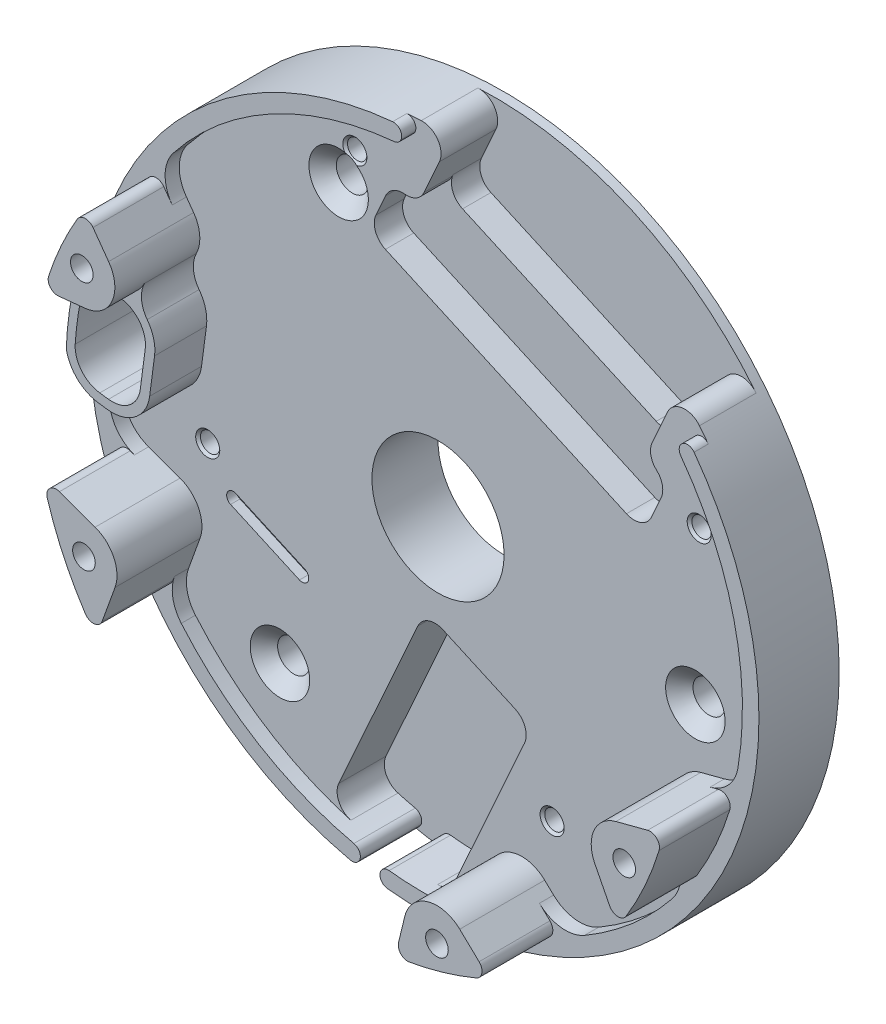
from build123d import *
from build123d.topology import SkipClean

# Parameters (mm, degrees)
BOSS_EXTRUDE1_DEPTH                                 = 5
BOSS_EXTRUDE1_DEPTH_BACK                            = 2
SKETCH1_R                                           = 35.5
SKETCH1_R_2                                         = 1.5
SKETCH1_R_3                                         = 7
CUT_EXTRUDE2_REACH                                  = 52.69
FILLET1_R                                           = 4
BOSS_EXTRUDE2_START                                 = -12.5
BOSS_EXTRUDE2_DEPTH                                 = 12.5
M2_5_TAPPED_HOLE1_D                                 = 2.05
M2_5_TAPPED_HOLE1_CSINK_D                           = 2.55
M2_5_TAPPED_HOLE1_CSINK_ANGLE                       = 90
CSK_FOR_M3_COUNTERSUNK_FLAT_HEAD_SCREW1_D           = 3.4
CSK_FOR_M3_COUNTERSUNK_FLAT_HEAD_SCREW1_DEPTH       = 7
CSK_FOR_M3_COUNTERSUNK_FLAT_HEAD_SCREW1_CSINK_D     = 6.3
CSK_FOR_M3_COUNTERSUNK_FLAT_HEAD_SCREW1_CSINK_ANGLE = 90
SKETCH8_R                                           = 2.75
CUT_EXTRUDE6_DEPTH                                  = 2.2
CUT_EXTRUDE7_DEPTH                                  = 51.690235746
CUT_EXTRUDE7_DEPTH_BACK                             = 6
CUT_EXTRUDE8_START                                  = -5
CUT_EXTRUDE8_DEPTH                                  = 5
CUT_EXTRUDE9_DEPTH                                  = 3
CUT_EXTRUDE10_DEPTH                                 = 1
FILLET2_R                                           = 2
FILLET3_R                                           = 2
BOSS_EXTRUDE3_DEPTH                                 = 1.5
BOSS_EXTRUDE3_DIRECTION_2_REACH                     = 52.69
BOSS_EXTRUDE4_DEPTH                                 = 9
CUT_EXTRUDE11_REACH                                 = 52.919
SKETCH21_R                                          = 35.5
SKETCH21_R_2                                        = 33.9
BOSS_EXTRUDE6_DEPTH                                 = 5.5
FILLET4_R                                           = 0.875
FILLET5_R                                           = 4
FILLET6_R                                           = 1
FILLET7_R                                           = 3
FILLET8_R                                           = 2


# Read off the part's stored shape, not the designer's step: M2 Tapped Hole2, M2 Clearance Hole1
with BuildPart() as part:
    # Sketch1 → Boss-Extrude1 (new, two sides: drawn at the far end of the back side and taken through both)
    with BuildSketch(Plane.XY.offset(-BOSS_EXTRUDE1_DEPTH_BACK)):
        Circle(SKETCH1_R)
        with Locations((-10.52379439, 25.406687144)):
            Circle(SKETCH1_R_2, mode=Mode.SUBTRACT)
        with Locations((27.264733688, -3.589470286)):
            Circle(SKETCH1_R_2, mode=Mode.SUBTRACT)
        with Locations((-16.740939298, -21.817216858)):
            Circle(SKETCH1_R_2, mode=Mode.SUBTRACT)
        Circle(SKETCH1_R_3, mode=Mode.SUBTRACT)
    extrude(amount=BOSS_EXTRUDE1_DEPTH + BOSS_EXTRUDE1_DEPTH_BACK)

    # Sketch2 → Cut-Extrude2 (cut, up to next)
    with BuildSketch(Plane(origin=(0, 0, -2), x_dir=(-1, 0, 0), z_dir=(0, 0, -1)), mode=Mode.PRIVATE) as cut_extrude2_sk1:
        with BuildLine():
            Line((32.396934208, 10.316911066), (24.002964381, 9.211823974))
            Line((24.002964381, 9.211823974), (25.569278688, -2.685514363))
            Line((25.569278688, -2.685514363), (33.963248514, -1.58042727))
            ThreePointArc((33.963248514, -1.58042727), (33.709125287, 4.437890535), (32.396934208, 10.316911066))
        make_face()
    cut_extrude2_tool1 = extrude(cut_extrude2_sk1.sketch, amount=-CUT_EXTRUDE2_REACH, mode=Mode.PRIVATE) & part.part
    add(cut_extrude2_tool1.solids().sort_by_distance((-29.161149, 3.839138, -2))[0], mode=Mode.SUBTRACT)

    # Fillet1
    fillet1_edges = [part.edges().sort_by_distance(p)[0] for p in [
        (-32.396934208, 10.316911066, 1.5),
        (-33.963248514, -1.58042727, 1.5),
        (-25.569278688, -2.685514363, 1.5),
        (-24.002964381, 9.211823974, 1.5),
    ]]
    fillet(fillet1_edges, radius=FILLET1_R)

    # Sketch3 → Boss-Extrude2 (add)
    with BuildSketch(Plane(origin=(0, 0, -2), x_dir=(-1, 0, 0), z_dir=(0, 0, -1)).offset(BOSS_EXTRUDE2_START)):
        with BuildLine():
            Line((24.52506915, 5.246044528), (25.047173919, 1.280265083))
            ThreePointArc((25.047173919, 1.280265083), (26.577907648, -1.37104351), (29.535058133, -2.163409594))
            Line((29.535058133, -2.163409594), (30.460333066, -2.041594838))
            ThreePointArc((30.460333066, -2.041594838), (33.028662825, -0.615345749), (33.929992071, 2.180742555))
            ThreePointArc((33.929992071, 2.180742555), (33.709125287, 4.437890535), (33.338273332, 6.675292593))
            ThreePointArc((33.338273332, 6.675292593), (31.743975231, 9.142825324), (28.89401876, 9.855743499))
            Line((28.89401876, 9.855743499), (27.968743827, 9.733928743))
            ThreePointArc((27.968743827, 9.733928743), (25.317435234, 8.203195013), (24.52506915, 5.246044528))
        make_face()
        with BuildLine():
            Line((25.516514011, 5.37657072), (26.03861878, 1.410791275))
            ThreePointArc((26.03861878, 1.410791275), (27.186669077, -0.577690169), (29.404531941, -1.171964732))
            Line((29.404531941, -1.171964732), (30.329806874, -1.050149977))
            ThreePointArc((30.329806874, -1.050149977), (32.256054193, 0.01953684), (32.932051127, 2.116603068))
            ThreePointArc((32.932051127, 2.116603068), (32.717680425, 4.307364343), (32.357735882, 6.478960458))
            ThreePointArc((32.357735882, 6.478960458), (31.162012306, 8.329610007), (29.024544952, 8.864298637))
            Line((29.024544952, 8.864298637), (28.099270019, 8.742483881))
            ThreePointArc((28.099270019, 8.742483881), (26.110788575, 7.594433584), (25.516514011, 5.37657072))
        make_face(mode=Mode.SUBTRACT)
    extrude(amount=BOSS_EXTRUDE2_DEPTH)

    # M2.5 Tapped Hole1 (through all)
    with Locations(Plane.XY.offset(5)):
        with Locations((-8.808106595, 29.179055129), (27.673288448, 12.77454917), (12.089007787, -21.88277612), (-24.392387256, -5.478270161)):
            CounterSinkHole(M2_5_TAPPED_HOLE1_D / 2, M2_5_TAPPED_HOLE1_CSINK_D / 2, counter_sink_angle=M2_5_TAPPED_HOLE1_CSINK_ANGLE)

    # CSK for M3 Countersunk Flat Head Screw1
    with Locations(Plane.XY.offset(5)):
        with Locations((-10.52379439, 25.406687144), (27.264733688, -3.589470286), (-16.740939298, -21.817216858)):
            CounterSinkHole(CSK_FOR_M3_COUNTERSUNK_FLAT_HEAD_SCREW1_D / 2, CSK_FOR_M3_COUNTERSUNK_FLAT_HEAD_SCREW1_CSINK_D / 2, depth=CSK_FOR_M3_COUNTERSUNK_FLAT_HEAD_SCREW1_DEPTH, counter_sink_angle=CSK_FOR_M3_COUNTERSUNK_FLAT_HEAD_SCREW1_CSINK_ANGLE)

    # Sketch8 → Cut-Extrude6 (cut)
    with BuildSketch(Plane(origin=(0, 0, -2), x_dir=(-1, 0, 0), z_dir=(0, 0, -1))):
        with Locations((10.52379439, 25.406687144)):
            Circle(SKETCH8_R)
        with Locations((16.740939298, -21.817216858)):
            Circle(SKETCH8_R)
        with Locations((-27.264733688, -3.589470286)):
            Circle(SKETCH8_R)
    extrude(amount=-CUT_EXTRUDE6_DEPTH, mode=Mode.SUBTRACT)

    # Sketch9 → Cut-Extrude7 (cut, two sides: drawn at the far end of the back side and taken through both)
    with BuildSketch(Plane.XY.offset(5).offset(-CUT_EXTRUDE7_DEPTH_BACK)):
        Polygon((75.817321638, 200.915630738), (1.422431593, 35.471491206), (-2.2212529, 27.368431368), (21.947671316, 16.50044617), (25.591355809, 24.603506008), (99.986245853, 190.04764554), (248.776025942, 520.935924604), (224.607101727, 531.803909802), align=None)
    extrude(amount=CUT_EXTRUDE7_DEPTH + CUT_EXTRUDE7_DEPTH_BACK, mode=Mode.SUBTRACT)

    # Sketch10 → Cut-Extrude8 (cut)
    with BuildSketch(Plane.XY.offset(5).offset(CUT_EXTRUDE8_START)):
        with BuildLine():
            Line((-1.319723163, -9.274606772), (-12.148608512, -33.35657823))
            ThreePointArc((-12.148608512, -33.35657823), (-5.929149168, -35.001359833), (0.485025181, -35.496686473))
            Line((0.485025181, -35.496686473), (9.9895093, -14.360003619))
            Line((9.9895093, -14.360003619), (-1.319723163, -9.274606772))
        make_face()
    extrude(amount=CUT_EXTRUDE8_DEPTH, mode=Mode.SUBTRACT)

    # Sketch11 → Cut-Extrude9 (cut)
    with BuildSketch(Plane.XY.offset(5)):
        Polygon((-4.729348809, 28.496241153), (24.455767225, 15.372636386), (21.790035007, 9.444409691), (-7.395081027, 22.568014458), align=None)
    extrude(amount=-CUT_EXTRUDE9_DEPTH, mode=Mode.SUBTRACT)

    # Sketch12 → Cut-Extrude10 (cut)
    with BuildSketch(Plane.XY.offset(5)):
        with BuildLine():
            Line((-21.40042799, -8.577976559), (-14.104148981, -11.858877751))
            ThreePointArc((-14.104148981, -11.858877751), (-13.752803423, -12.784381018), (-14.67830669, -13.135726577))
            Line((-14.67830669, -13.135726577), (-21.974585699, -9.854825385))
            ThreePointArc((-21.974585699, -9.854825385), (-22.325931258, -8.929322118), (-21.40042799, -8.577976559))
        make_face()
    extrude(amount=-CUT_EXTRUDE10_DEPTH, mode=Mode.SUBTRACT)

    # Fillet2
    fillet2_edges = [part.edges().sort_by_distance(p)[0] for p in [
        (1.422431593, 35.471491206, 2),
        (25.591355809, 24.603506008, 2),
        (-2.2212529, 27.368431368, 0.5),
        (21.947671316, 16.50044617, 0.5),
        (-7.395081027, 22.568014458, 3.5),
        (-4.729348809, 28.496241153, 3.5),
        (24.455767225, 15.372636386, 3.5),
        (21.790035007, 9.444409691, 3.5),
    ]]
    fillet(fillet2_edges, radius=FILLET2_R)

    # Fillet3
    fillet3_edges = [part.edges().sort_by_distance(p)[0] for p in [
        (-2.2212529, 27.368431368, 3.5),
        (21.947671316, 16.50044617, 3.5),
    ]]
    fillet(fillet3_edges, radius=FILLET3_R)

    # Sketch13 → Boss-Extrude3 (add)
    with SkipClean():  # the faces are left unmerged after this step: merging them gives an invalid solid
        with BuildSketch(Plane.XY.offset(5)):
            with BuildLine():
                Line((-6.352709332, -33.146728106), (-7.089353949, -34.784925766))
                ThreePointArc((-7.089353949, -34.784925766), (-35.400529869, 2.655651525), (-1.820273042, 35.453301765))
                Line((-1.820273042, 35.453301765), (-2.632427, 33.647181577))
                ThreePointArc((-2.632427, 33.647181577), (-33.697770867, 1.876895995), (-6.352709332, -33.146728106))
            make_face()
            with BuildLine():
                Line((-4.306998446, -33.4740536), (-5.055315747, -35.138209725))
                ThreePointArc((-5.055315747, -35.138209725), (-2.292163903, -35.425922495), (0.485025181, -35.496686473))
                ThreePointArc((0.485025181, -35.496686473), (32.097560493, -15.165639136), (27.729656943, 22.165651938))
                Line((27.729656943, 22.165651938), (26.917502984, 20.35953175))
                ThreePointArc((26.917502984, 20.35953175), (29.19456211, -16.933400226), (-4.306998446, -33.4740536))
            make_face()
        extrude(amount=BOSS_EXTRUDE3_DEPTH)

    # Boss-Extrude3 direction 2: up to this face of the body (flat: up to its plane)
    boss_extrude3_direction_2_end = Plane(part.part.faces().sort_by_distance((-0.958119383, -23.267547359, 0))[0])
    # Sketch13 → Boss-Extrude3 direction 2 (add, up to the picked face)
    with BuildSketch(Plane.XY.offset(5), mode=Mode.PRIVATE) as boss_extrude3_direction_2_sk1:
        with BuildLine():
            Line((-6.352709332, -33.146728106), (-7.089353949, -34.784925766))
            ThreePointArc((-7.089353949, -34.784925766), (-35.400529869, 2.655651525), (-1.820273042, 35.453301765))
            Line((-1.820273042, 35.453301765), (-2.632427, 33.647181577))
            ThreePointArc((-2.632427, 33.647181577), (-33.697770867, 1.876895995), (-6.352709332, -33.146728106))
        make_face()
    boss_extrude3_direction_2_tool1 = split(extrude(boss_extrude3_direction_2_sk1.sketch, amount=-BOSS_EXTRUDE3_DIRECTION_2_REACH, mode=Mode.PRIVATE), bisect_by=boss_extrude3_direction_2_end, keep=Keep.BOTH, mode=Mode.PRIVATE)
    # Sketch13 → Boss-Extrude3 direction 2 (add, up to the picked face)
    with BuildSketch(Plane.XY.offset(5), mode=Mode.PRIVATE) as boss_extrude3_direction_2_sk2:
        with BuildLine():
            Line((-4.306998446, -33.4740536), (-5.055315747, -35.138209725))
            ThreePointArc((-5.055315747, -35.138209725), (-2.292163903, -35.425922495), (0.485025181, -35.496686473))
            ThreePointArc((0.485025181, -35.496686473), (32.097560493, -15.165639136), (27.729656943, 22.165651938))
            Line((27.729656943, 22.165651938), (26.917502984, 20.35953175))
            ThreePointArc((26.917502984, 20.35953175), (29.19456211, -16.933400226), (-4.306998446, -33.4740536))
        make_face()
    boss_extrude3_direction_2_tool2 = split(extrude(boss_extrude3_direction_2_sk2.sketch, amount=-BOSS_EXTRUDE3_DIRECTION_2_REACH, mode=Mode.PRIVATE), bisect_by=boss_extrude3_direction_2_end, keep=Keep.BOTH, mode=Mode.PRIVATE)
    add(boss_extrude3_direction_2_tool1.solids().sort_by(Axis((-2.936786, 34.869702, 5), (0, 0, -1)))[0])
    add(boss_extrude3_direction_2_tool2.solids().sort_by(Axis((-4.038185, -34.595256, 5), (0, 0, -1)))[0])

    # Sketch14 → Boss-Extrude4 (add)
    with SkipClean():  # the faces are left unmerged after this step: merging them gives an invalid solid
        with BuildSketch(Plane.XY.offset(5)):
            with BuildLine():
                Line((27.845637941, -9.531883819), (32.88927519, -8.21617779))
                ThreePointArc((32.88927519, -8.21617779), (30.917982298, -13.9028188), (27.972133554, -19.151233496))
                Line((27.972133554, -19.151233496), (25.609344635, -14.505096652))
                ThreePointArc((25.609344635, -14.505096652), (25.53697653, -11.483154171), (27.845637941, -9.531883819))
            make_face()
            with BuildLine():
                Line((5.486533564, -29.396393477), (4.467720012, -33.604307431))
                ThreePointArc((4.467720012, -33.604307431), (9.565446748, -32.522488043), (14.437131, -30.672124942))
                Line((14.437131, -30.672124942), (11.302377395, -27.685849548))
                ThreePointArc((11.302377395, -27.685849548), (7.900663981, -26.862232012), (5.486533564, -29.396393477))
            make_face()
            with BuildLine():
                Line((-27.318831353, -10.112586624), (-32.919360528, -8.094794773))
                ThreePointArc((-32.919360528, -8.094794773), (-30.677006402, -14.426755636), (-27.230169011, -20.192273167))
                Line((-27.230169011, -20.192273167), (-25.212377159, -14.591743992))
                ThreePointArc((-25.212377159, -14.591743992), (-25.337940391, -11.91590436), (-27.318831353, -10.112586624))
            make_face()
            with BuildLine():
                Line((-28.376125466, 9.436392506), (-32.683546689, 8.999765319))
                ThreePointArc((-32.683546689, 8.999765319), (-30.917982298, 13.9028188), (-28.421790506, 18.477332719))
                Line((-28.421790506, 18.477332719), (-25.889949659, 14.965310108))
                ThreePointArc((-25.889949659, 14.965310108), (-25.53697653, 11.483154171), (-28.376125466, 9.436392506))
            make_face()
        extrude(amount=BOSS_EXTRUDE4_DEPTH)

    # M2 Tapped Hole2 outline → M2 Tapped Hole2 (revolve, cut)
    with SkipClean():  # the faces are left unmerged after this step: merging them gives an invalid solid
        with BuildSketch(Plane(origin=(28.729098596, -12.918548443, 0), x_dir=(1, 0, 0), z_dir=(0, -1, 0))):
            Polygon((0, 14), (0, -0.480688495), (0.8, 0), (0.8, 14), align=None)
        revolve(axis=Axis((28.729098596, -12.918548443, 0), (0, 0, 1)), mode=Mode.SUBTRACT)

    # M2 Tapped Hole2 2 outline → M2 Tapped Hole2 2 (revolve, cut)
    with SkipClean():  # the faces are left unmerged after this step: merging them gives an invalid solid
        with BuildSketch(Plane(origin=(8.888246978, -30.220011013, 0), x_dir=(1, 0, 0), z_dir=(0, -1, 0))):
            Polygon((0, 14), (0, -0.480688495), (0.8, 0), (0.8, 14), align=None)
        revolve(axis=Axis((8.888246978, -30.220011013, 0), (0, 0, 1)), mode=Mode.SUBTRACT)

    # M2 Tapped Hole2 3 outline → M2 Tapped Hole2 3 (revolve, cut)
    with SkipClean():  # the faces are left unmerged after this step: merging them gives an invalid solid
        with BuildSketch(Plane(origin=(-28.50518294, -13.405392405, 0), x_dir=(1, 0, 0), z_dir=(0, -1, 0))):
            Polygon((0, 14), (0, -0.480688495), (0.8, 0), (0.8, 14), align=None)
        revolve(axis=Axis((-28.50518294, -13.405392405, 0), (0, 0, 1)), mode=Mode.SUBTRACT)

    # M2 Tapped Hole2 4 outline → M2 Tapped Hole2 4 (revolve, cut)
    with SkipClean():  # the faces are left unmerged after this step: merging them gives an invalid solid
        with BuildSketch(Plane(origin=(-28.729098596, 12.918548443, 0), x_dir=(1, 0, 0), z_dir=(0, -1, 0))):
            Polygon((0, 14), (0, -0.480688495), (0.8, 0), (0.8, 14), align=None)
        revolve(axis=Axis((-28.729098596, 12.918548443, 0), (0, 0, 1)), mode=Mode.SUBTRACT)

    # M2 Clearance Hole1 outline → M2 Clearance Hole1 (revolve, cut)
    with SkipClean():  # the faces are left unmerged after this step: merging them gives an invalid solid
        with BuildSketch(Plane(origin=(28.729098596, -12.918548443, 0), x_dir=(1, 0, 0), z_dir=(0, -1, 0))):
            Polygon((0.8, 14), (0.8, 8.759655752), (1.2, 9), (1.2, 14), align=None)
        revolve(axis=Axis((28.729098596, -12.918548443, 0), (0, 0, 1)), mode=Mode.SUBTRACT)

    # M2 Clearance Hole1 2 outline → M2 Clearance Hole1 2 (revolve, cut)
    with SkipClean():  # the faces are left unmerged after this step: merging them gives an invalid solid
        with BuildSketch(Plane(origin=(8.888246978, -30.220011013, 0), x_dir=(1, 0, 0), z_dir=(0, -1, 0))):
            Polygon((0.8, 14), (0.8, 8.759655752), (1.2, 9), (1.2, 14), align=None)
        revolve(axis=Axis((8.888246978, -30.220011013, 0), (0, 0, 1)), mode=Mode.SUBTRACT)

    # M2 Clearance Hole1 3 outline → M2 Clearance Hole1 3 (revolve, cut)
    with SkipClean():  # the faces are left unmerged after this step: merging them gives an invalid solid
        with BuildSketch(Plane(origin=(-28.50518294, -13.405392405, 0), x_dir=(1, 0, 0), z_dir=(0, -1, 0))):
            Polygon((0.8, 14), (0.8, 8.759655752), (1.2, 9), (1.2, 14), align=None)
        revolve(axis=Axis((-28.50518294, -13.405392405, 0), (0, 0, 1)), mode=Mode.SUBTRACT)

    # M2 Clearance Hole1 4 outline → M2 Clearance Hole1 4 (revolve, cut)
    with SkipClean():  # the faces are left unmerged after this step: merging them gives an invalid solid
        with BuildSketch(Plane(origin=(-28.729098596, 12.918548443, 0), x_dir=(1, 0, 0), z_dir=(0, -1, 0))):
            Polygon((0.8, 14), (0.8, 8.759655752), (1.2, 9), (1.2, 14), align=None)
        revolve(axis=Axis((-28.729098596, 12.918548443, 0), (0, 0, 1)), mode=Mode.SUBTRACT)

    # Sketch21 → Cut-Extrude11 (cut, up to next)
    with BuildSketch(Plane.XY.offset(6.5), mode=Mode.PRIVATE) as cut_extrude11_sk1:
        Circle(SKETCH21_R)
        Circle(SKETCH21_R_2, mode=Mode.SUBTRACT)
    cut_extrude11_tool1 = extrude(cut_extrude11_sk1.sketch, amount=CUT_EXTRUDE11_REACH, mode=Mode.PRIVATE) & part.part
    add(cut_extrude11_tool1.solids().sort_by_distance((-34.495908, 0, 6.5))[0], mode=Mode.SUBTRACT)

    # Sketch22 → Boss-Extrude6 (add)
    with SkipClean():  # the faces are left unmerged after this step: merging them gives an invalid solid
        with BuildSketch(Plane.XY.offset(5)):
            with BuildLine():
                Line((-31.819620576, 9.08733828), (-32.683546689, 8.999765319))
                ThreePointArc((-32.683546689, 8.999765319), (-32.870359477, 8.291529888), (-33.041827087, 7.579423644))
                ThreePointArc((-33.041827087, 7.579423644), (-32.523576927, 8.408640964), (-31.819620576, 9.08733828))
            make_face()
        extrude(amount=BOSS_EXTRUDE6_DEPTH)

    # Fillet4
    # the kernel refuses this fillet: 0.875 mm, written as the material it takes off along each edge
    with BuildSketch(Plane(origin=(-2.632427, 33.647181577, 5), x_dir=(-0.9963387292935687, -0.08549348811270209, 0), z_dir=(0, 0, 1))) as fillet4_piece_1:
        with BuildLine():
            CenterArc((0.514232565, -0.874975254), FILLET4_R, 90.430912371, 60.452773243)
            Line((-0.25019693, -0.449214115), (0, 0))
            ThreePointArc((0, 0), (0.253825946, -0.000954497), (0.507651892, 0))
        make_face()
    extrude(amount=2.785476141, mode=Mode.SUBTRACT)
    with BuildSketch(Plane(origin=(-1.820273042, 35.453301765, 5), x_dir=(-0.41011264897732513, -0.9120348760594637, 0), z_dir=(0, 0, 1))) as fillet4_piece_2:
        with BuildLine():
            CenterArc((1.466128757, -0.875), FILLET4_R, 90, 119.547226757)
            ThreePointArc((0.704922932, -1.306498195), (0.34563133, -0.656934307), (0, 0))
            Line((0, 0), (1.466128757, 0))
        make_face()
    extrude(amount=5.211345674, mode=Mode.SUBTRACT)
    with BuildSketch(Plane(origin=(27.729656943, 22.165651938, 5), x_dir=(-0.41011264897733873, -0.9120348760594577, 0), z_dir=(0, 0, 1))) as fillet4_piece_3:
        with BuildLine():
            CenterArc((1.466128757, 0.875), FILLET4_R, 150.452773243, 119.547226757)
            ThreePointArc((0.704922932, 1.306498195), (0.34563133, 0.656934307), (0, 0))
            Line((0, 0), (1.466128757, 0))
        make_face()
    extrude(amount=5.211345674, mode=Mode.SUBTRACT)
    with BuildSketch(Plane(origin=(26.917502984, 20.35953175, 5), x_dir=(0.4101126489773329, 0.9120348760594602, 0), z_dir=(0, 0, 1))) as fillet4_piece_4:
        with BuildLine():
            CenterArc((0.514190456, -0.875), FILLET4_R, 90, 60.452773243)
            ThreePointArc((-0.247015369, -0.443501805), (-0.122673804, -0.222215345), (0, 0))
            Line((0, 0), (0.514190456, 0))
        make_face()
    extrude(amount=2.785476141, mode=Mode.SUBTRACT)
    with BuildSketch(Plane(origin=(-4.306998446, -33.4740536, 5), x_dir=(0.9929792584712338, -0.11828859727767001, 0), z_dir=(0, 0, -1))) as fillet4_piece_5:
        with BuildLine():
            CenterArc((0.642545255, 0.874961363), FILLET4_R, 197.418568486, 72.042993881)
            Line((-0.19233019, 0.613030089), (0, 0))
            ThreePointArc((0, 0), (0.317161277, 0.001490274), (0.634322555, 0))
        make_face()
    extrude(amount=5, mode=Mode.SUBTRACT)
    with BuildSketch(Plane(origin=(-6.352709332, -33.146728106, 5), x_dir=(-0.9790021466235207, 0.20384993722475947, 0), z_dir=(0, 0, -1))) as fillet4_piece_6:
        with BuildLine():
            CenterArc((1.089223617, -0.874888969), FILLET4_R, 90.912768644, 101.536959033)
            Line((0.23479877, -1.063524016), (0, 0))
            ThreePointArc((0, 0), (0.53764237, -0.004282632), (1.075284741, 0))
        make_face()
    extrude(amount=5, mode=Mode.SUBTRACT)
    with BuildSketch(Plane(origin=(-5.055315747, -35.138209725, 5), x_dir=(0.9920688711319626, -0.12569548492668045, 0), z_dir=(0, 0, -1))) as fillet4_piece_7:
        with BuildLine():
            CenterArc((1.182262216, -0.874875637), FILLET4_R, 89.03398439, 107.957006118)
            Line((0.345455338, -1.130569298), (0, 0))
            ThreePointArc((0, 0), (0.598507075, 0.00504558), (1.197014151, 0))
        make_face()
    extrude(amount=5, mode=Mode.SUBTRACT)
    with BuildSketch(Plane(origin=(-7.089353949, -34.784925766, 5), x_dir=(-0.9777935246502878, 0.20957056842974606, 0), z_dir=(0, 0, -1))) as fillet4_piece_8:
        with BuildLine():
            CenterArc((0.7071213, 0.874955513), FILLET4_R, 192.114723777, 78.463040967)
            Line((-0.14839187, 0.691319416), (0, 0))
            ThreePointArc((0, 0), (0.35797228, -0.001804893), (0.71594456, 0))
        make_face()
    extrude(amount=5, mode=Mode.SUBTRACT)
    with BuildSketch(Plane(origin=(-7.089353949, -34.784925766, 5), x_dir=(0.4101126489773508, 0.9120348760594521, 0), z_dir=(0, 0, 1))) as fillet4_piece_9:
        with BuildLine():
            CenterArc((0.70706625, 0.875), FILLET4_R, 191.536959033, 78.463040967)
            ThreePointArc((-0.15025516, 0.7), (-0.076892277, 0.349621207), (0, 0))
            Line((0, 0), (0.70706625, 0))
        make_face()
    extrude(amount=3.2898614, mode=Mode.SUBTRACT)
    with BuildSketch(Plane(origin=(-5.055315747, -35.138209725, 5), x_dir=(0.9920688711319626, -0.12569548492668045, 0), z_dir=(0, 0, 1))) as fillet4_piece_10:
        with BuildLine():
            CenterArc((1.182262216, 0.874875637), FILLET4_R, 163.009009491, 107.957006118)
            Line((0.345455338, 1.130569298), (0, 0))
            ThreePointArc((0, 0), (0.598507075, -0.00504558), (1.197014151, 0))
        make_face()
    extrude(amount=4.492535377, mode=Mode.SUBTRACT)
    with BuildSketch(Plane(origin=(-6.352709332, -33.146728106, 5), x_dir=(-0.9790021466235207, 0.20384993722475947, 0), z_dir=(0, 0, 1))) as fillet4_piece_11:
        with BuildLine():
            CenterArc((1.089223617, 0.874888969), FILLET4_R, 167.550272323, 101.536959033)
            Line((0.23479877, 1.063524016), (0, 0))
            ThreePointArc((0, 0), (0.53764237, 0.004282632), (1.075284741, 0))
        make_face()
    extrude(amount=4.222836063, mode=Mode.SUBTRACT)
    with BuildSketch(Plane(origin=(-4.306998446, -33.4740536, 5), x_dir=(0.9929792584712338, -0.11828859727767001, 0), z_dir=(0, 0, 1))) as fillet4_piece_12:
        with BuildLine():
            CenterArc((0.642545255, -0.874961363), FILLET4_R, 90.538437633, 72.042993881)
            Line((-0.19233019, -0.613030089), (0, 0))
            ThreePointArc((0, 0), (0.317161277, -0.001490274), (0.634322555, 0))
        make_face()
    extrude(amount=3.106231598, mode=Mode.SUBTRACT)

    # Fillet5
    fillet5_edges = [part.edges().sort_by_distance(p)[0] for p in [
        (27.894603125, -18.998779343, 5.75),
        (32.723777816, -8.259350184, 5.75),
        (4.505588566, -33.447902351, 5.75),
        (14.320614505, -30.561127273, 5.75),
        (-32.749710086, -8.15591744, 5.75),
        (-27.169046344, -20.022622725, 5.75),
        (-28.327683836, 18.346793411, 5.75),
    ]]
    fillet(fillet5_edges, radius=FILLET5_R)

    # Fillet6
    # the kernel refuses this fillet: 1 mm, written as the material it takes off along each edge
    with BuildSketch(Plane(origin=(27.972133554, -19.151233496, 6.5), x_dir=(0.5432907602840155, 0.8395446085765881, 0), z_dir=(0, 0, 1))) as fillet6_piece_1:
        with BuildLine():
            CenterArc((1.736628811, 0.99966201), FILLET6_R, 149.863510987, 121.626200287)
            Line((0.871796954, 1.50172362), (0, 0))
            ThreePointArc((0, 0), (0.881313124, -0.011457878), (1.762626248, 0))
        make_face()
    extrude(amount=11.90656562, mode=Mode.SUBTRACT)
    with BuildSketch(Plane(origin=(32.88927519, -8.21617779, 6.5), x_dir=(-0.26750553596356375, -0.9635563233298023, 0), z_dir=(0, 0, 1))) as fillet6_piece_2:
        with BuildLine():
            CenterArc((1.736628811, -0.99966201), FILLET6_R, 88.510288726, 121.626200287)
            Line((0.871796954, -1.50172362), (0, 0))
            ThreePointArc((0, 0), (0.881313124, 0.011457878), (1.762626248, 0))
        make_face()
    extrude(amount=11.90656562, mode=Mode.SUBTRACT)
    with BuildSketch(Plane(origin=(4.467720012, -33.604307431, 6.5), x_dir=(0.988078427996925, 0.15395135636663143, 0), z_dir=(0, 0, 1)), Plane(origin=(-28.421790506, 18.477332719, 6.5), x_dir=(-0.5261468841766501, -0.850393706627232, 0), z_dir=(0, 0, 1))) as fillet6_piece_3:
        with BuildLine():
            CenterArc((1.495553361, 0.999749346), FILLET6_R, 157.533571636, 113.74930345)
            Line((0.571449759, 1.381891378), (0, 0))
            ThreePointArc((0, 0), (0.758970942, -0.008497184), (1.517941884, 0))
        make_face()
    extrude(amount=11.29485471, mode=Mode.SUBTRACT)
    with BuildSketch(Plane(origin=(14.437131, -30.672124942, 6.5), x_dir=(-0.914090350560342, -0.40551058064182605, 0), z_dir=(0, 0, 1))) as fillet6_piece_4:
        with BuildLine():
            CenterArc((1.495553361, -0.999749346), FILLET6_R, 88.717124914, 113.74930345)
            Line((0.571449759, -1.381891378), (0, 0))
            ThreePointArc((0, 0), (0.758970942, 0.008497184), (1.517941884, 0))
        make_face()
    extrude(amount=11.29485471, mode=Mode.SUBTRACT)
    with BuildSketch(Plane(origin=(-32.919360528, -8.094794773, 6.5), x_dir=(0.26677654907021775, -0.9637584100106135, 0), z_dir=(0, 0, 1))) as fillet6_piece_5:
        with BuildLine():
            CenterArc((1.932444904, 0.999581474), FILLET6_R, 144.714079672, 126.943650661)
            Line((1.116165337, 1.577238526), (0, 0))
            ThreePointArc((0, 0), (0.98068686, -0.014188024), (1.96137372, 0))
        make_face()
    extrude(amount=12.403434299, mode=Mode.SUBTRACT)
    with BuildSketch(Plane(origin=(-27.230169011, -20.192273167, 6.5), x_dir=(-0.5721559183901744, 0.8201448683318674, 0), z_dir=(0, 0, 1))) as fillet6_piece_6:
        with BuildLine():
            CenterArc((1.932444904, -0.999581474), FILLET6_R, 88.342269667, 126.943650661)
            Line((1.116165337, -1.577238526), (0, 0))
            ThreePointArc((0, 0), (0.98068686, 0.014188024), (1.96137372, 0))
        make_face()
    extrude(amount=12.403434299, mode=Mode.SUBTRACT)
    with BuildSketch(Plane(origin=(-32.683546689, 8.999765319, 10.5), x_dir=(0.28699840227569284, 0.9579310607195068, 0), z_dir=(0, 0, 1))) as fillet6_piece_7:
        with BuildLine():
            CenterArc((1.495553361, -0.999749346), FILLET6_R, 88.717124914, 113.74930345)
            Line((0.571449759, -1.381891378), (0, 0))
            ThreePointArc((0, 0), (0.758970942, 0.008497184), (1.517941884, 0))
        make_face()
    extrude(amount=7.29485471, mode=Mode.SUBTRACT)

    # Fillet7
    # the kernel refuses this fillet: 3 mm, written as the material it adds along each edge
    with BuildSketch(Plane(origin=(-33.742953035, 0.68965244, 5), x_dir=(0.8056031928975169, -0.5924554798407438, 0), z_dir=(0, 0, 1))) as fillet7_piece_1:
        with BuildLine():
            CenterArc((6.173476029, -2.628126311), FILLET7_R, 118.831450807, 107.018647404)
            Line((4.083862074, -4.780686071), (3.874900679, -4.995942047))
            ThreePointArc((3.874900679, -4.995942047), (1.702256519, -2.680507221), (-0.245262392, -0.172760989))
            Line((-0.245262392, -0.172760989), (0.175026979, 0.243650481))
            ThreePointArc((0.175026979, 0.243650481), (4.117961157, 0.007317292), (4.582101771, 0.262812631))
            Line((4.582101771, 0.262812631), (4.726772158, 0))
        make_face()
    extrude(amount=1.5)
    with BuildSketch(Plane(origin=(-27.496794211, 9.642662929, -1.57118869), x_dir=(0.743237362769279, 0.6690278189909351, 0), z_dir=(0, 0, 1))) as fillet7_piece_2:
        with BuildLine():
            CenterArc((3.645039656, -2.793605508), FILLET7_R, 111.377059091, 63.878568666)
            ThreePointArc((0.655318762, -2.545474543), (0.542713858, -1.21737265), (0, 0))
            ThreePointArc((0, 0), (1.275763879, -0.240793575), (2.551527759, 0))
        make_face()
    extrude(amount=12.07118869)

    # Fillet8
    fillet8_edges = [part.edges().sort_by_distance(p)[0] for p in [
        (-1.319723163, -9.274606772, 2.5),
        (9.9895093, -14.360003619, 2.5),
        (-11.428878084, -31.75599543, 2.5),
        (1.281396084, -33.725665658, 2.5),
    ]]
    fillet(fillet8_edges, radius=FILLET8_R)


solid = part.part
